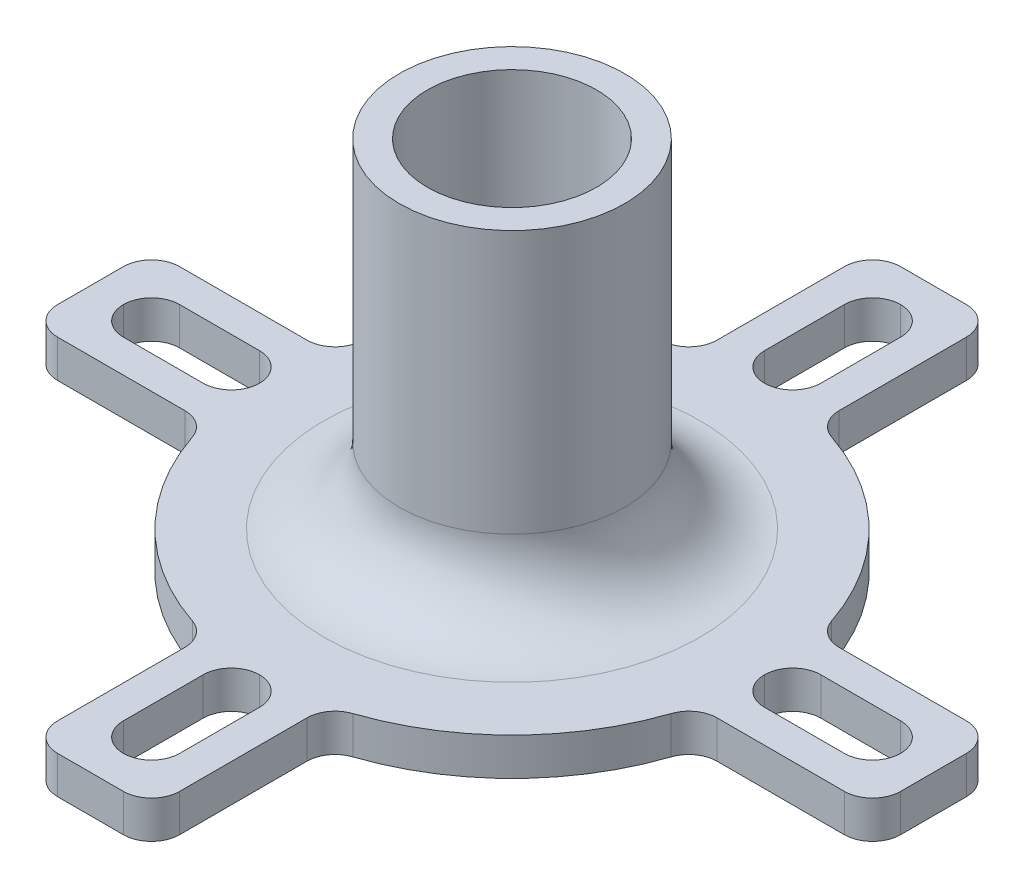
from build123d import *

# Parameters (mm, degrees)
SKETCH1_R                = 13.442813203
BOSS_EXTRUDE1_DEPTH      = 2
SKETCH2_W                = 6.5
SKETCH2_H                = 18
SKETCH2_W_2              = 3
SKETCH2_H_2              = 14.5
BOSS_EXTRUDE3_DEPTH      = 2
FILLET1_R                = 1.5
CIRPATTERN1_COUNT        = 4
FILLET1_OF_CIRPATTERN1_R = 1.5
SKETCH3_R                = 6
SKETCH3_R_2              = 4.5
BOSS_EXTRUDE4_DEPTH      = 18
FILLET2_R                = 4


with BuildPart() as part:
    # Sketch1 → Boss-Extrude1 (new body)
    with BuildSketch(Plane(origin=(0, 0, 0), x_dir=(1, 0, 0), z_dir=(0, 1, 0))):
        with Locations(Location((0, 0, 0), (0, 0, 270))):
            Circle(SKETCH1_R)
    extrude(amount=BOSS_EXTRUDE1_DEPTH)

    # Sketch2 → Boss-Extrude3 (add)
    with BuildSketch(Plane(origin=(0, 2, 0), x_dir=(1, 0, 0), z_dir=(0, 1, 0))):
        with Locations((0, 13.442813203)):
            Rectangle(SKETCH2_W, SKETCH2_H)
        with Locations((0, 13.442813203)):
            Rectangle(SKETCH2_W_2, SKETCH2_H_2, mode=Mode.SUBTRACT)
    boss_extrude3 = extrude(amount=-BOSS_EXTRUDE3_DEPTH)

    # Fillet1
    fillet1_edges = [part.edges().sort_by_distance(p)[0] for p in [
        (3.25, 1, -13.044030313),
        (3.25, 1, -22.442813203),
        (-3.25, 1, -22.442813203),
        (-3.25, 1, -13.044030313),
        (-1.5, 1, -13.35886323),
        (1.5, 1, -13.35886323),
        (1.5, 1, -20.692813203),
        (-1.5, 1, -20.692813203),
    ]]
    fillet(fillet1_edges, radius=FILLET1_R - 0.0001)  # a hair under: the kernel refuses the full size

    # CirPattern1: Boss-Extrude3 ×4 about axis
    cirpattern1_axis = Axis((0, 0, 0), (0, 1, 0))
    for i in range(1, CIRPATTERN1_COUNT):
        add(boss_extrude3.rotate(cirpattern1_axis, i * 360 / CIRPATTERN1_COUNT))

    # Fillet1 of CirPattern1
    fillet1_of_cirpattern1_edges = [part.edges().sort_by_distance(p)[0] for p in [
        (-13.044030313, 1, -3.25),
        (-22.442813203, 1, -3.25),
        (-22.442813203, 1, 3.25),
        (-13.044030313, 1, 3.25),
        (-13.35886323, 1, 1.5),
        (-13.35886323, 1, -1.5),
        (-20.692813203, 1, -1.5),
        (-20.692813203, 1, 1.5),
        (-3.25, 1, 13.044030313),
        (-3.25, 1, 22.442813203),
        (3.25, 1, 22.442813203),
        (3.25, 1, 13.044030313),
        (1.5, 1, 13.35886323),
        (-1.5, 1, 13.35886323),
        (-1.5, 1, 20.692813203),
        (1.5, 1, 20.692813203),
        (13.044030313, 1, 3.25),
        (22.442813203, 1, 3.25),
        (22.442813203, 1, -3.25),
        (13.044030313, 1, -3.25),
        (13.35886323, 1, -1.5),
        (13.35886323, 1, 1.5),
        (20.692813203, 1, 1.5),
        (20.692813203, 1, -1.5),
    ]]
    fillet(fillet1_of_cirpattern1_edges, radius=FILLET1_OF_CIRPATTERN1_R - 0.0001)  # a hair under: the kernel refuses the full size

    # Sketch3 → Boss-Extrude4 (add)
    with BuildSketch(Plane(origin=(0, 2, 0), x_dir=(1, 0, 0), z_dir=(0, 1, 0))):
        with Locations(Location((0, 0, 0), (0, 0, 270))):
            Circle(SKETCH3_R)
        with Locations(Location((0, 0, 0), (0, 0, 270))):
            Circle(SKETCH3_R_2, mode=Mode.SUBTRACT)
    extrude(amount=BOSS_EXTRUDE4_DEPTH)

    # Fillet2
    fillet2_edges = [part.edges().sort_by_distance(p)[0] for p in [
        (0, 2, -6),
    ]]
    fillet(fillet2_edges, radius=FILLET2_R)


solid = part.part
